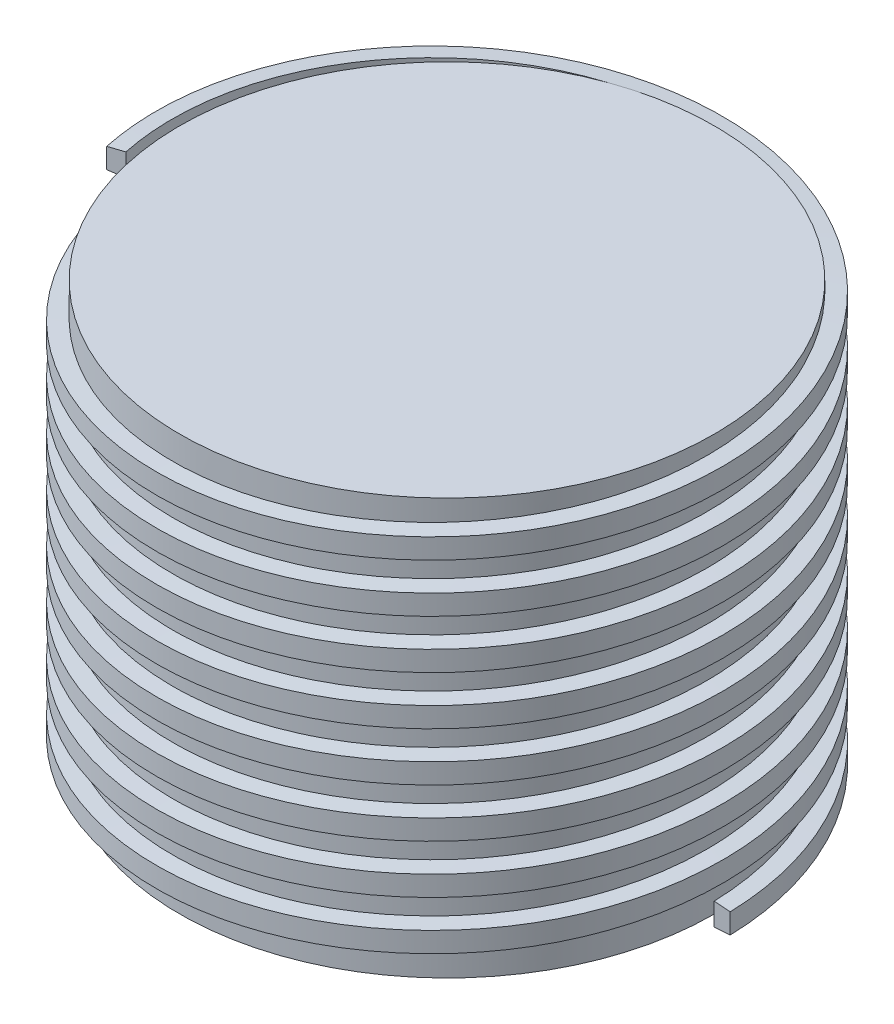
from build123d import *

# Parameters (mm, degrees)
SKETCH1_R           = 4.5
BOSS_EXTRUDE1_DEPTH = 7
SWEEP1_PITCH        = 0.82


with BuildPart() as part:
    # Sketch1 → Boss-Extrude1 (new body)
    with BuildSketch(Plane(origin=(0, 0, 0), x_dir=(1, 0, 0), z_dir=(0, 1, 0))):
        with Locations(Location((0, 0, 0), (0, 0, 270))):
            Circle(SKETCH1_R)
    extrude(amount=BOSS_EXTRUDE1_DEPTH)

    # Sweep1: the profile of Sketch2 profile screwed along a right-hand helix of 8.536585 turns, 8 arcs to a turn; built about Z, then put on its axis
    sweep1_z = Axis((0, 0, 0), (0, 0, 1))
    sweep1_corners = [(4.77, 0, -0.17), (4.77, 0, 0.17), (4.4997, 0, 0.190022222), (4.4997, 0, -0.190022222)]
    with BuildLine(mode=Mode.PRIVATE) as sweep1_profile:
        Line(sweep1_corners[0], sweep1_corners[1])
        Line(sweep1_corners[1], sweep1_corners[2])
        Line(sweep1_corners[2], sweep1_corners[3])
        Line(sweep1_corners[3], sweep1_corners[0])
    sweep1_cap = Face(sweep1_profile.wire())
    sweep1_turn_angles = [0, 22.5, 45, 67.5, 90, 112.5, 135, 157.5, 180, 202.5, 225, 247.5, 270, 292.5, 315, 337.5, 360]
    sweep1_turn_weights = [1, 0.9238795325112867, 1, 0.9238795325112867, 1, 0.9238795325112867, 1, 0.9238795325112867, 1, 0.9238795325112867, 1, 0.9238795325112867, 1, 0.9238795325112867, 1, 0.9238795325112867, 1]
    sweep1_turn_rails = [Edge.make_bspline([Vector(p[0], p[1], 0).rotate(sweep1_z, sweep1_turn_angles[k]) / sweep1_turn_weights[k] + Vector(0, 0, p[2] + SWEEP1_PITCH * sweep1_turn_angles[k] / 360) for k in range(17)], [0, 0, 0, 1, 1, 2, 2, 3, 3, 4, 4, 5, 5, 6, 6, 7, 7, 8, 8, 8], 2, sweep1_turn_weights) for p in sweep1_corners]
    sweep1_turn_sides = [Face.make_surface_from_curves(sweep1_turn_rails[p[0]], sweep1_turn_rails[p[1]]) for p in [(0, 1), (1, 2), (2, 3), (3, 0)]]
    sweep1_last_angles = [2880, 2902.5, 2925, 2947.5, 2970, 2992.5, 3015, 3037.5, 3060, 3066.585365854, 3073.170731707]
    sweep1_last_weights = [1, 0.9238795325112867, 1, 0.9238795325112867, 1, 0.9238795325112867, 1, 0.9238795325112867, 1, 0.993402089759677, 1]
    sweep1_last_rails = [Edge.make_bspline([Vector(p[0], p[1], 0).rotate(sweep1_z, sweep1_last_angles[k]) / sweep1_last_weights[k] + Vector(0, 0, p[2] + SWEEP1_PITCH * sweep1_last_angles[k] / 360) for k in range(11)], [0, 0, 0, 1, 1, 2, 2, 3, 3, 4, 4, 5, 5, 5], 2, sweep1_last_weights) for p in sweep1_corners]
    sweep1_last_sides = [Face.make_surface_from_curves(sweep1_last_rails[p[0]], sweep1_last_rails[p[1]]) for p in [(0, 1), (1, 2), (2, 3), (3, 0)]]
    sweep1 = Plane(origin=(0, 0, 0), x_dir=(1, 0, 0), z_dir=(0, 1, 0)) * Solid(Shell([*[p.moved(Location((0, 0, SWEEP1_PITCH * i))) for i in range(8) for p in sweep1_turn_sides], *sweep1_last_sides, sweep1_cap, sweep1_cap.rotate(sweep1_z, 3073.170731707).moved(Location((0, 0, SWEEP1_PITCH * 3073.170731707 / 360)))]))
    add(sweep1)


solid = part.part
